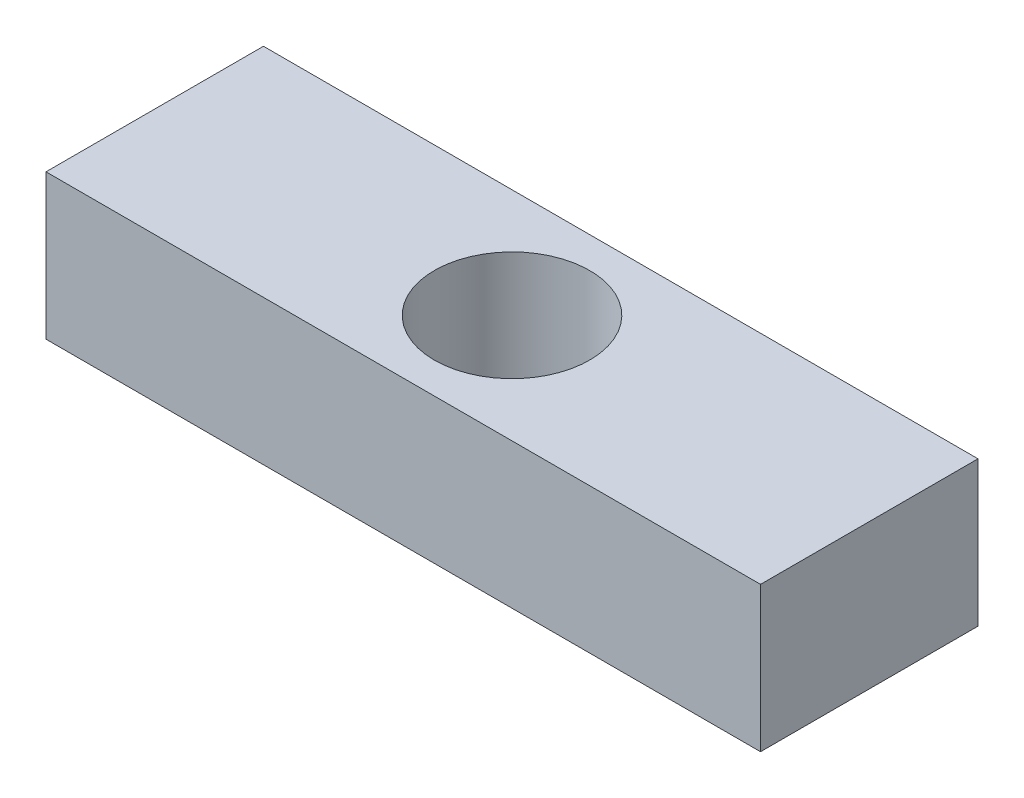
from build123d import *

# Parameters (mm, degrees)
SKETCH1_W           = 138
SKETCH1_H           = 42
SKETCH1_R           = 15
BOSS_EXTRUDE1_DEPTH = 28


with BuildPart() as part:
    # Sketch1 → Boss-Extrude1 (new body)
    with BuildSketch(Plane(origin=(0, 0, 0), x_dir=(1, 0, 0), z_dir=(0, 1, 0))):
        Rectangle(SKETCH1_W, SKETCH1_H)
        Circle(SKETCH1_R, mode=Mode.SUBTRACT)
    extrude(amount=BOSS_EXTRUDE1_DEPTH)


solid = part.part
